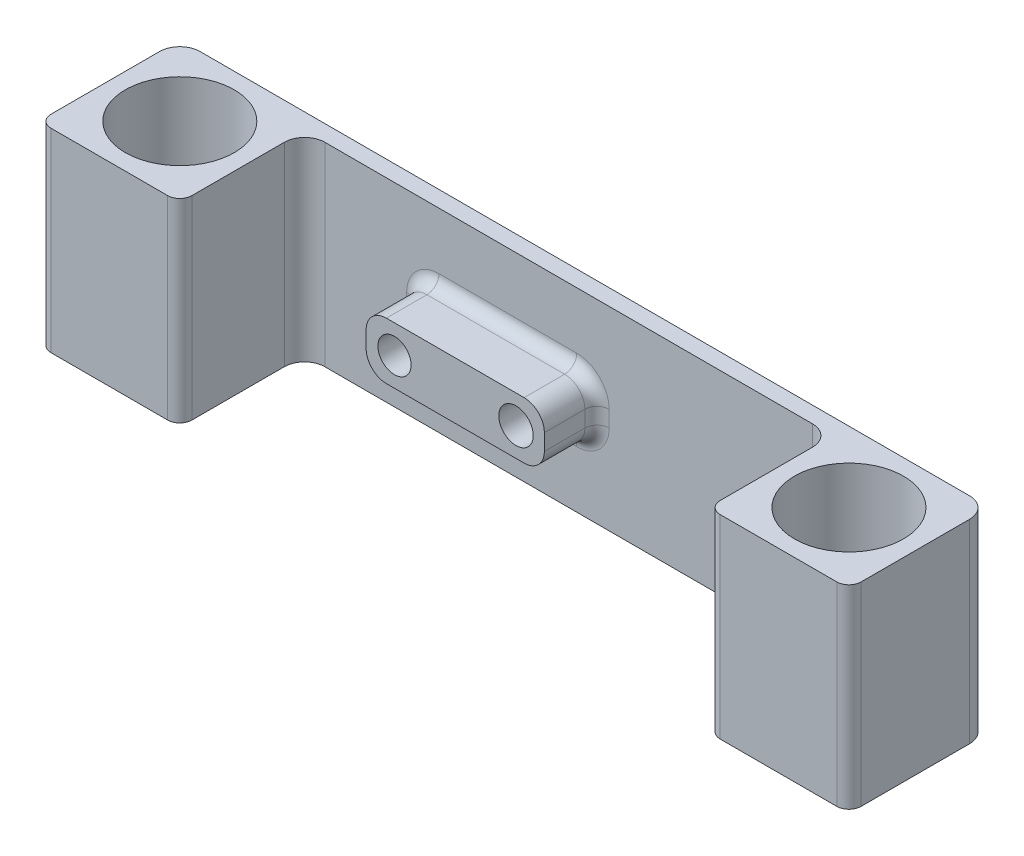
from build123d import *

# Parameters (mm, degrees)
SKETCH1_R           = 13.45
BOSS_EXTRUDE2_DEPTH = 48
SKETCH7_W           = 44
SKETCH7_H           = 14
SKETCH7_R           = 4.25
SKETCH7_R_2         = 4.1
BOSS_EXTRUDE3_DEPTH = 13
FILLET1_R           = 3
FILLET2_R           = 5
FILLET3_R           = 5
FILLET4_R           = 3


with BuildPart() as part:
    # Sketch1 → Boss-Extrude2 (new body)
    with BuildSketch(Plane(origin=(0, 0, 0), x_dir=(1, 0, 0), z_dir=(0, 1, 0))):
        Polygon((-17.4, 17.4), (17.4, 17.4), (17.4, -17.4), (-17.4, -17.4), (-17.4, 13.4), (-82.6, 13.4), (-82.6, 17.4), align=None)
        Circle(SKETCH1_R, mode=Mode.SUBTRACT)
    boss_extrude2 = extrude(amount=BOSS_EXTRUDE2_DEPTH)

    # Mirror2: Boss-Extrude2 across plane
    add(boss_extrude2.mirror(Plane(origin=(-82.6, 48, -17.4), x_dir=(0, 0, 1), z_dir=(1, 0, 0))))

    # Sketch7 → Boss-Extrude3 (add)
    with BuildSketch(Plane.XY.offset(-13.4)):
        with Locations((-97.6, 24)):
            Rectangle(SKETCH7_W, SKETCH7_H)
        with Locations((-82.6, 24)):
            Circle(SKETCH7_R, mode=Mode.SUBTRACT)
        with Locations((-112.6, 24)):
            Circle(SKETCH7_R_2, mode=Mode.SUBTRACT)
    extrude(amount=BOSS_EXTRUDE3_DEPTH)

    # Fillet1
    fillet1_edges = [part.edges().sort_by_distance(p)[0] for p in [
        (17.4, 24, 17.4),
        (-17.4, 24, 17.4),
        (-182.6, 24, 17.4),
        (-147.8, 24, 17.4),
    ]]
    fillet(fillet1_edges, radius=FILLET1_R)

    # Fillet2
    fillet2_edges = [part.edges().sort_by_distance(p)[0] for p in [
        (17.4, 24, -17.4),
        (-17.4, 24, -13.4),
        (-182.6, 24, -17.4),
        (-147.8, 24, -13.4),
    ]]
    fillet(fillet2_edges, radius=FILLET2_R)

    # Fillet3
    fillet3_edges = [part.edges().sort_by_distance(p)[0] for p in [
        (-75.6, 31, -6.9),
        (-75.6, 17, -6.9),
        (-119.6, 31, -6.9),
        (-119.6, 17, -6.9),
    ]]
    fillet(fillet3_edges, radius=FILLET3_R)

    # Fillet4
    fillet4_edges = [part.edges().sort_by_distance(p)[0] for p in [
        (-118.135533906, 18.464466094, -13.4),
        (-119.6, 24, -13.4),
        (-118.135533906, 29.535533906, -13.4),
        (-97.6, 31, -13.4),
        (-77.064466094, 29.535533906, -13.4),
        (-75.6, 24, -13.4),
        (-77.064466094, 18.464466094, -13.4),
        (-97.6, 17, -13.4),
    ]]
    fillet(fillet4_edges, radius=FILLET4_R)


solid = part.part
